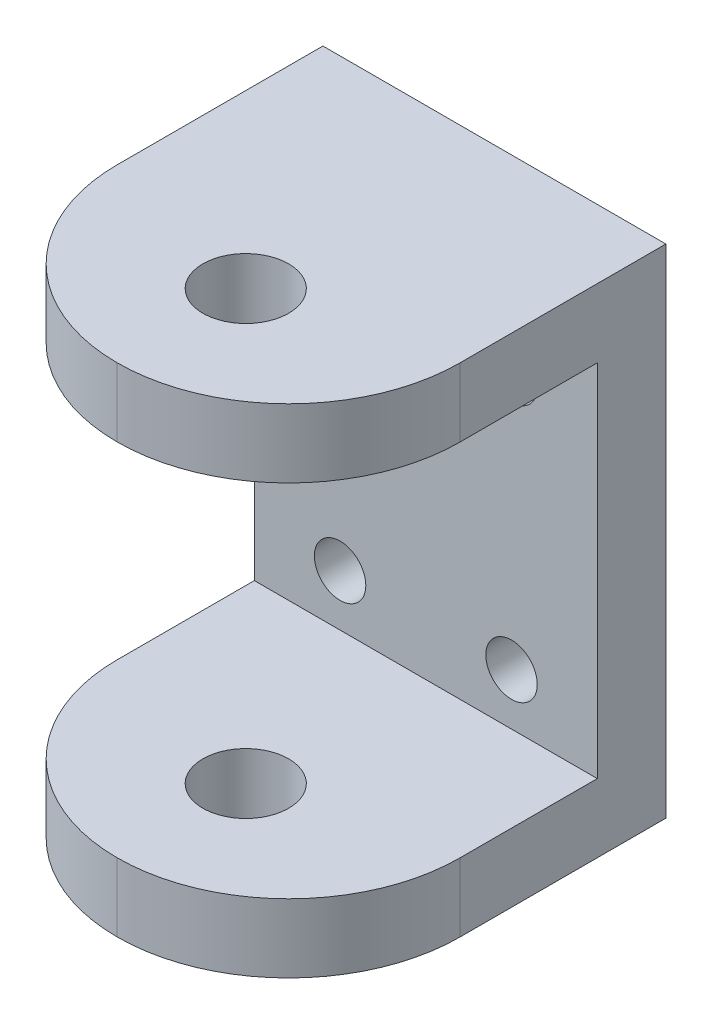
from build123d import *

# Parameters (mm, degrees)
SKETCH_1_W          = 20
SKETCH_1_H          = 29
SKETCH_1_R          = 1.5
EXTRUDE_1_DEPTH     = 4
SKETCH_2_W          = 20
SKETCH_2_H          = 4
EXTRUDE_2_DEPTH     = 18
CUT_EXTRUDE_1_DEPTH = 38.749172176
FILLET_1_R          = 10


with BuildPart() as part:
    # 草图1 → 凸台-拉伸1 (new body)
    with BuildSketch(Plane.XY):
        Rectangle(SKETCH_1_W, SKETCH_1_H)
        with Locations((5, 7.5)):
            Circle(SKETCH_1_R, mode=Mode.SUBTRACT)
        with Locations((-5, 7.5)):
            Circle(SKETCH_1_R, mode=Mode.SUBTRACT)
        with Locations((-5, -7.5)):
            Circle(SKETCH_1_R, mode=Mode.SUBTRACT)
        with Locations((5, -7.5)):
            Circle(SKETCH_1_R, mode=Mode.SUBTRACT)
    extrude(amount=EXTRUDE_1_DEPTH)

    # 草图2 → 凸台-拉伸2 (add)
    with BuildSketch(Plane.XY.offset(4)):
        with Locations((0, 12.5)):
            Rectangle(SKETCH_2_W, SKETCH_2_H)
        with Locations((0, -12.5)):
            Rectangle(SKETCH_2_W, SKETCH_2_H)
    extrude(amount=EXTRUDE_2_DEPTH)

    # 草图3 → 切除-拉伸1 (cut, through all)
    with BuildSketch(Plane.XZ.offset(14.5)):
        with BuildLine():
            ThreePointArc((2.5, 14.5), (0, 17), (-2.5, 14.5))
            Line((-2.5, 14.5), (2.5, 14.5))
        make_face()
        with BuildLine():
            Line((2.5, 14.5), (-2.5, 14.5))
            ThreePointArc((-2.5, 14.5), (0, 12), (2.5, 14.5))
        make_face()
    extrude(amount=-CUT_EXTRUDE_1_DEPTH, mode=Mode.SUBTRACT)

    # 圆角1
    fillet_1_edges = [part.edges().sort_by_distance(p)[0] for p in [
        (10, -12.5, 22),
        (10, 12.5, 22),
        (-10, 12.5, 22),
        (-10, -12.5, 22),
    ]]
    fillet(fillet_1_edges, radius=FILLET_1_R - 0.0001)  # a hair under: the kernel refuses the full size


solid = part.part
